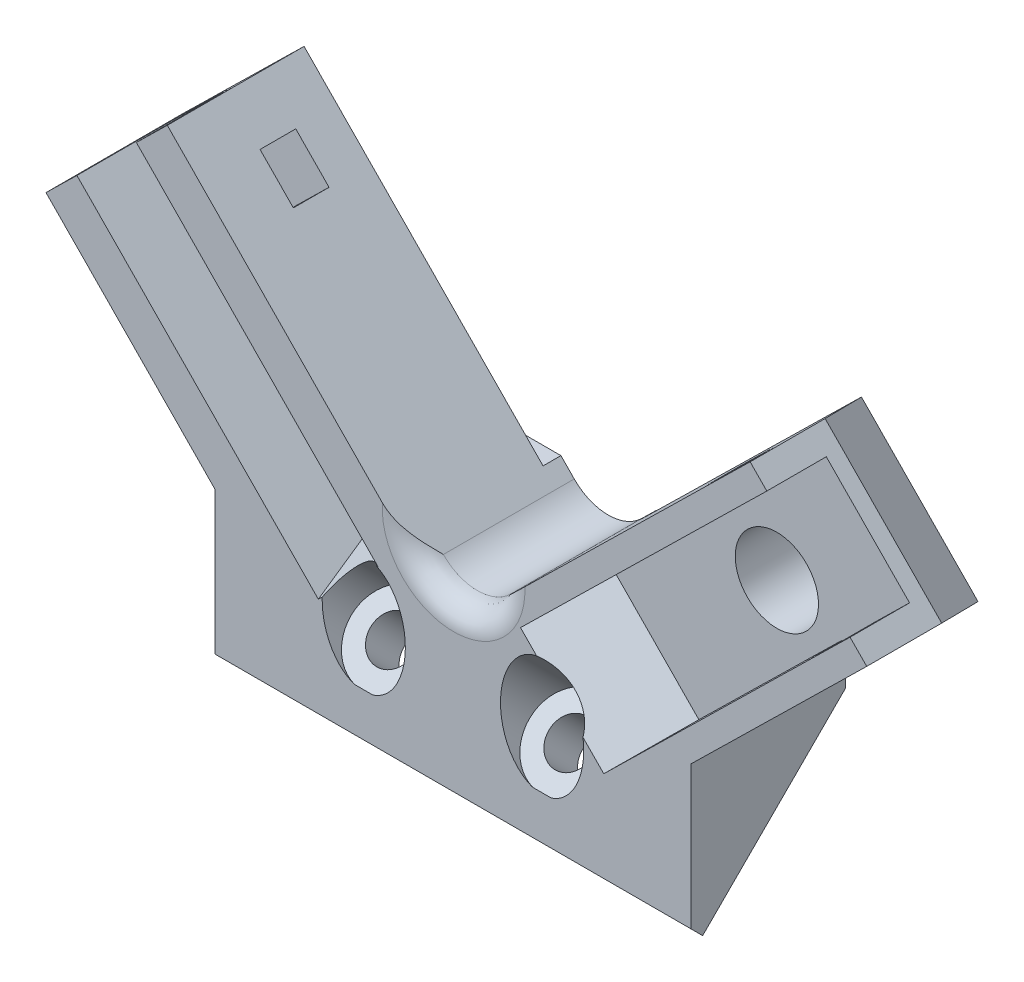
from build123d import *

# Parameters (mm, degrees)
BOSS_EXTRU_1_DEPTH       = 15
ENL_V_MAT_EXTRU_1_DEPTH  = 5
ENL_V_MAT_EXTRU_2_DEPTH  = 8
CHANFREIN1_SIZE          = 11
CHANFREIN1_SIZE_2        = 13.109289519
ESQUISSE8_W              = 3
ESQUISSE8_H              = 4
ENL_V_MAT_EXTRU_6_DEPTH  = 50
ESQUISSE7_W              = 4
ESQUISSE7_H              = 3
ENL_V_MAT_EXTRU_5_DEPTH  = 50
ESQUISSE6_W              = 69.009802941
ESQUISSE6_H              = 2
ENL_V_MAT_EXTRU_4_DEPTH  = 100
CHANFREIN2_SIZE          = 11
CHANFREIN2_SIZE_2        = 30.222251614
ESQUISSE9_W              = 40
ESQUISSE9_H              = 13
BOSS_EXTRU_2_DEPTH       = 5
CHANFREIN4_SIZE          = 12
ESQUISSE10_R             = 1.75
ENL_V_MAT_EXTRU_7_DEPTH  = 1.5
CHANFREIN5_SIZE          = 3
CHANFREIN5_SIZE2         = 5.196152423
ESQUISSE11_R             = 1.75
ENL_V_MAT_EXTRU_8_DEPTH  = 50.355263045
ESQUISSE12_R             = 3.5
ENL_V_MAT_EXTRU_9_DEPTH  = 2.5
ESQUISSE13_R             = 3.5
ENL_V_MAT_EXTRU_10_DEPTH = 5.5
CONG_1_R                 = 4
CHANFREIN10_SIZE         = 1
ESQUISSE14_R             = 1.85
ENL_V_MAT_EXTRU_11_DEPTH = 46.879646797
ENL_V_START              = -4
ESQUISSE15_R             = 3.5
ENL_V_MAT_EXTRU_12_DEPTH = 42.879646797


with BuildPart() as part:
    # Esquisse1 → Boss.-Extru.1 (new body)
    with BuildSketch(Plane.XY):
        Polygon((-20, 0), (20, 0), (20, 8), (34.7949995, 22.5020002), (24.9949995, 32.5), (0, 8), (-24.014803441, 32.5), (-34.214803441, 22.5020002), (-20, 8), align=None)
    extrude(amount=BOSS_EXTRU_1_DEPTH)

    # Esquisse2 → Enlèv. mat.-Extru.1 (cut)
    with BuildSketch(Plane.XY.offset(15)):
        Polygon((26.3949995, 31.071714314), (13.540428329, 18.471714314), (20.540428329, 11.330285886), (33.3949995, 23.930285886), align=None)
    extrude(amount=-ENL_V_MAT_EXTRU_1_DEPTH, mode=Mode.SUBTRACT)

    # Esquisse3 → Enlèv. mat.-Extru.2 (cut)
    with BuildSketch(Plane.XY.offset(15)):
        Polygon((-31.614303391, 25.0510001), (-19.014303391, 12.196428929), (-14.015303491, 17.096428929), (-26.615303491, 29.9510001), align=None)
    extrude(amount=-ENL_V_MAT_EXTRU_2_DEPTH, mode=Mode.SUBTRACT)

    # Chanfrein1
    # the kernel refuses this chamfer: 13.109289519, 11 mm, written as the material it takes off along each edge
    with BuildSketch(Plane(origin=(13.540428329, 18.471714314, 15), x_dir=(-0.7141428428542841, -0.7000000000000011, 0), z_dir=(0.7000000000000011, -0.7141428428542841, 0))) as chanfrein1_piece_1_section:
        Polygon((CHANFREIN1_SIZE, 0), (0, CHANFREIN1_SIZE_2), (0, 0), align=None)
    chanfrein1_piece_1 = extrude(amount=10, mode=Mode.PRIVATE)
    chanfrein1_piece_1 = split(chanfrein1_piece_1, bisect_by=Plane(origin=(13.540428329, 18.471714314, 10), z_dir=(0, 0, 1)), keep=Keep.TOP, mode=Mode.PRIVATE)
    add(chanfrein1_piece_1, mode=Mode.SUBTRACT)

    # Esquisse8 → Enlèv. mat.-Extru.6 (cut)
    with BuildSketch(Plane(origin=(-6.20080008, -6.0779998, 0), x_dir=(0, 0, 1), z_dir=(-0.7141428428542848, -0.7000000000000004, 0))):
        with Locations((8.5, 34.020004802)):
            Rectangle(ESQUISSE8_W, ESQUISSE8_H)
    extrude(amount=-ENL_V_MAT_EXTRU_6_DEPTH, mode=Mode.SUBTRACT)

    # Esquisse7 → Enlèv. mat.-Extru.5 (cut)
    with BuildSketch(Plane(origin=(5.80080008, -5.9179998, 0), x_dir=(0.714142842854285, 0.7000000000000002, 0), z_dir=(0.7000000000000002, -0.714142842854285, 0))):
        with Locations((34.6, 11.5)):
            Rectangle(ESQUISSE7_W, ESQUISSE7_H)
    extrude(amount=-ENL_V_MAT_EXTRU_5_DEPTH, mode=Mode.SUBTRACT)

    # Esquisse6 → Enlèv. mat.-Extru.4 (cut)
    with BuildSketch(Plane.XZ):
        with Locations((0.29009803, 1)):
            Rectangle(ESQUISSE6_W, ESQUISSE6_H)
    extrude(amount=-ENL_V_MAT_EXTRU_4_DEPTH, mode=Mode.SUBTRACT)

    # Chanfrein2
    # the kernel refuses this chamfer: 30.222251614, 11 mm, written as the material it takes off along each edge
    with BuildSketch(Plane(origin=(-19.014303391, 12.196428929, 15), x_dir=(0.7000000000000006, -0.7141428428542845, 0), z_dir=(0.7141428428542845, 0.7000000000000005, 0))) as chanfrein2_piece_1_section:
        Polygon((CHANFREIN2_SIZE, 0), (0, CHANFREIN2_SIZE_2), (0, 0), align=None)
    chanfrein2_piece_1 = extrude(amount=7, mode=Mode.PRIVATE)
    chanfrein2_piece_1 = split(chanfrein2_piece_1, bisect_by=Plane(origin=(-19.014303391, 12.196428929, 7), z_dir=(0, 0, 1)), keep=Keep.TOP, mode=Mode.PRIVATE)
    add(chanfrein2_piece_1, mode=Mode.SUBTRACT)

    # Esquisse9 → Boss.-Extru.2 (add)
    with BuildSketch(Plane.XZ):
        with Locations((0, 8.5)):
            Rectangle(ESQUISSE9_W, ESQUISSE9_H)
    extrude(amount=BOSS_EXTRU_2_DEPTH)

    # Chanfrein4
    chanfrein4_edges = [part.edges().sort_by_distance(p)[0] for p in [
        (0, -5, 2),
    ]]
    chamfer(chanfrein4_edges, length=CHANFREIN4_SIZE)

    # Esquisse10 → Enlèv. mat.-Extru.7 (cut)
    with BuildSketch(Plane(origin=(0, 0, 2), x_dir=(-1, 0, 0), z_dir=(0, 0, -1))):
        Polygon((-35.24, 27.99759976), (-35.24, 11.99759976), (34.76, 11.99759976), (34.76, 27.99759976), (34.76, 37.99759976), (-35.24, 37.99759976), align=None)
        with Locations((-22.24, 19.99759976)):
            Circle(ESQUISSE10_R, mode=Mode.SUBTRACT)
        with Locations((21.76, 19.99759976)):
            Circle(ESQUISSE10_R, mode=Mode.SUBTRACT)
    extrude(amount=-ENL_V_MAT_EXTRU_7_DEPTH, mode=Mode.SUBTRACT)

    # Chanfrein5
    chanfrein5_edges = [part.edges().sort_by_distance(p)[0] for p in [
        (29.8949995, 27.5010001, 3.5),
    ]]
    chanfrein5_side = [part.faces().sort_by_distance(p)[0] for p in [
        (29.178170188, 17.513536316, 3.5),
    ]]
    chamfer(chanfrein5_edges, length=CHANFREIN5_SIZE, length2=CHANFREIN5_SIZE2, reference=chanfrein5_side[0])

    # Esquisse11 → Enlèv. mat.-Extru.8 (cut, through all)
    with BuildSketch(Plane(origin=(0, 0, 2), x_dir=(-1, 0, 0), z_dir=(0, 0, -1))):
        with Locations((-22.24, 19.99759976)):
            Circle(ESQUISSE11_R)
        with Locations((21.76, 19.99759976)):
            Circle(ESQUISSE11_R)
    extrude(amount=-ENL_V_MAT_EXTRU_8_DEPTH, mode=Mode.SUBTRACT)

    # Esquisse12 → Enlèv. mat.-Extru.9 (cut)
    with BuildSketch(Plane.XY.offset(7)):
        with Locations((-21.76, 19.99759976)):
            Circle(ESQUISSE12_R)
    extrude(amount=-ENL_V_MAT_EXTRU_9_DEPTH, mode=Mode.SUBTRACT)

    # Esquisse13 → Enlèv. mat.-Extru.10 (cut)
    with BuildSketch(Plane.XY.offset(10)):
        with Locations((22.24, 19.99759976)):
            Circle(ESQUISSE13_R)
    extrude(amount=-ENL_V_MAT_EXTRU_10_DEPTH, mode=Mode.SUBTRACT)

    # Congé1
    cong_1_edges = [part.edges().sort_by_distance(p)[0] for p in [
        (0, 8, 8.5),
    ]]
    fillet(cong_1_edges, radius=CONG_1_R)

    # Chanfrein10
    chanfrein10_edges = [part.edges().sort_by_distance(p)[0] for p in [
        (0, -5, 15),
    ]]
    chamfer(chanfrein10_edges, length=CHANFREIN10_SIZE - 0.0001)  # a hair under: the kernel refuses the full size

    # Esquisse14 → Enlèv. mat.-Extru.11 (cut, through all)
    with BuildSketch(Plane(origin=(0, 4.5, 4.5), x_dir=(1, 0, 0), z_dir=(0, -0.7071067811865464, -0.7071067811865488))):
        with Locations(Location((-7.5, 7.435028843, 0), (0, 0, 270))):
            Circle(ESQUISSE14_R)
        with Locations(Location((7.5, 7.435028843, 0), (0, 0, 270))):
            Circle(ESQUISSE14_R)
    extrude(amount=-ENL_V_MAT_EXTRU_11_DEPTH, mode=Mode.SUBTRACT)

    # Esquisse15 → Enlèv. mat.-Extru.12 (cut, through all)
    with BuildSketch(Plane(origin=(0, 4.5, 4.5), x_dir=(1, 0, 0), z_dir=(0, -0.7071067811865464, -0.7071067811865488)).offset(ENL_V_START)):
        with Locations((-7.5, 7.435028843)):
            Circle(ESQUISSE15_R)
        with Locations((7.5, 7.435028843)):
            Circle(ESQUISSE15_R)
    extrude(amount=-ENL_V_MAT_EXTRU_12_DEPTH, mode=Mode.SUBTRACT)

    # Congé2: read off the stored shape, not the designer's step
    # Congé2 outline → Congé2 (revolve, cut)
    with BuildSketch(Plane(origin=(0.056571371, 13.656571371, 0), x_dir=(1, 0, 0), z_dir=(0, -1, 0))):
        with BuildLine():
            ThreePointArc((4, 13), (4.585786438, 14.414213562), (6, 15))
            Line((6, 15), (4, 15))
            Line((4, 15), (4, 13))
        make_face()
    revolve(axis=Axis((0.056571371, 13.656571371, 0), (0, 0, 1)), mode=Mode.SUBTRACT)


solid = part.part
